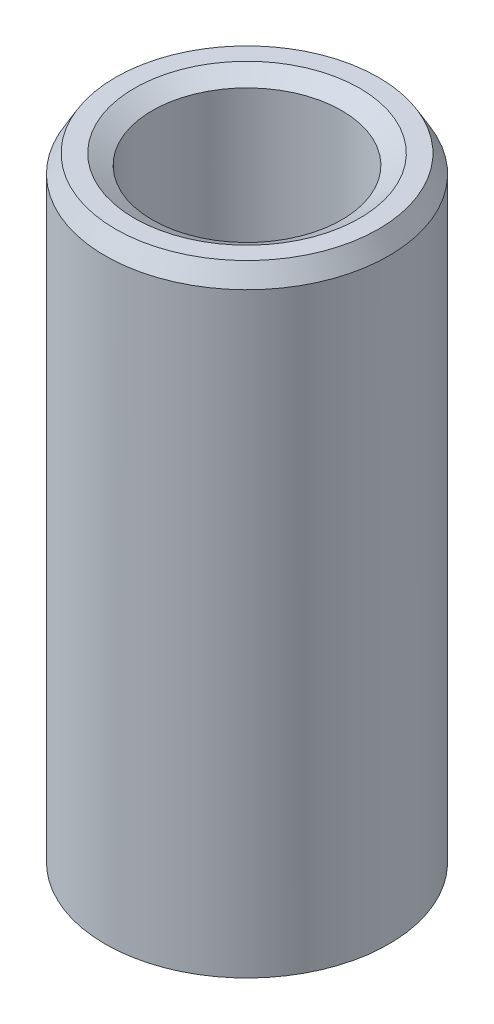
from build123d import *
from OCP.BRepFilletAPI import BRepFilletAPI_MakeChamfer

# Parameters (mm, degrees)
SKETCH1_R           = 27.5
BOSS_EXTRUDE1_DEPTH = 121.05196479
SKETCH2_R           = 18.362615434
CUT_EXTRUDE1_DEPTH  = 128.145893286
CHAMFER1_SIZE       = 3.48027471
CHAMFER1_SIZE2      = 2.00933754


with BuildPart() as part:
    # Sketch1 → Boss-Extrude1 (new body)
    with BuildSketch(Plane(origin=(0, 0, 0), x_dir=(1, 0, 0), z_dir=(0, 1, 0))):
        Circle(SKETCH1_R)
    extrude(amount=BOSS_EXTRUDE1_DEPTH)

    # Sketch2 → Cut-Extrude1 (cut, through all)
    with BuildSketch(Plane(origin=(0, 0, 0), x_dir=(1, 0, 0), z_dir=(0, 1, 0))):
        Circle(SKETCH2_R)
    extrude(amount=CUT_EXTRUDE1_DEPTH, mode=Mode.SUBTRACT)

    # Chamfer1: one chamfer whose edges measure the first distance from different faces: ONE call of the kernel's chamfer builder (chamfer() names one face for all edges)
    chamfer1_edges_1 = [part.edges().sort_by_distance(p)[0] for p in [
        (-18.362615434, 121.05196479, 0),
    ]]
    chamfer1_side_1 = [part.faces().sort_by_distance(p)[0] for p in [
        (-26.722182541, 121.05196479, 0),
    ]]
    chamfer1_edges_2 = [part.edges().sort_by_distance(p)[0] for p in [
        (-18.362615434, 0, 0),
    ]]
    chamfer1_side_2 = [part.faces().sort_by_distance(p)[0] for p in [
        (-18.362615434, 60.525982395, 0),
    ]]
    chamfer1_edges_3 = [part.edges().sort_by_distance(p)[0] for p in [
        (-27.5, 0, 0),
    ]]
    chamfer1_side_3 = [part.faces().sort_by_distance(p)[0] for p in [
        (-26.722182541, 0, 0),
    ]]
    chamfer1_edges_4 = [part.edges().sort_by_distance(p)[0] for p in [
        (-27.5, 121.05196479, 0),
    ]]
    chamfer1_side_4 = [part.faces().sort_by_distance(p)[0] for p in [
        (-27.5, 60.525982395, 0),
    ]]
    chamfer1 = BRepFilletAPI_MakeChamfer(part.part.solid().wrapped)
    for e in chamfer1_edges_1:
        chamfer1.Add(CHAMFER1_SIZE, CHAMFER1_SIZE2, e.wrapped, chamfer1_side_1[0].wrapped)  # the first distance lies on this face
    for e in chamfer1_edges_2:
        chamfer1.Add(CHAMFER1_SIZE, CHAMFER1_SIZE2, e.wrapped, chamfer1_side_2[0].wrapped)  # the first distance lies on this face
    for e in chamfer1_edges_3:
        chamfer1.Add(CHAMFER1_SIZE, CHAMFER1_SIZE2, e.wrapped, chamfer1_side_3[0].wrapped)  # the first distance lies on this face
    for e in chamfer1_edges_4:
        chamfer1.Add(CHAMFER1_SIZE, CHAMFER1_SIZE2, e.wrapped, chamfer1_side_4[0].wrapped)  # the first distance lies on this face
    add(Compound.cast(chamfer1.Shape()), mode=Mode.REPLACE)


solid = part.part
